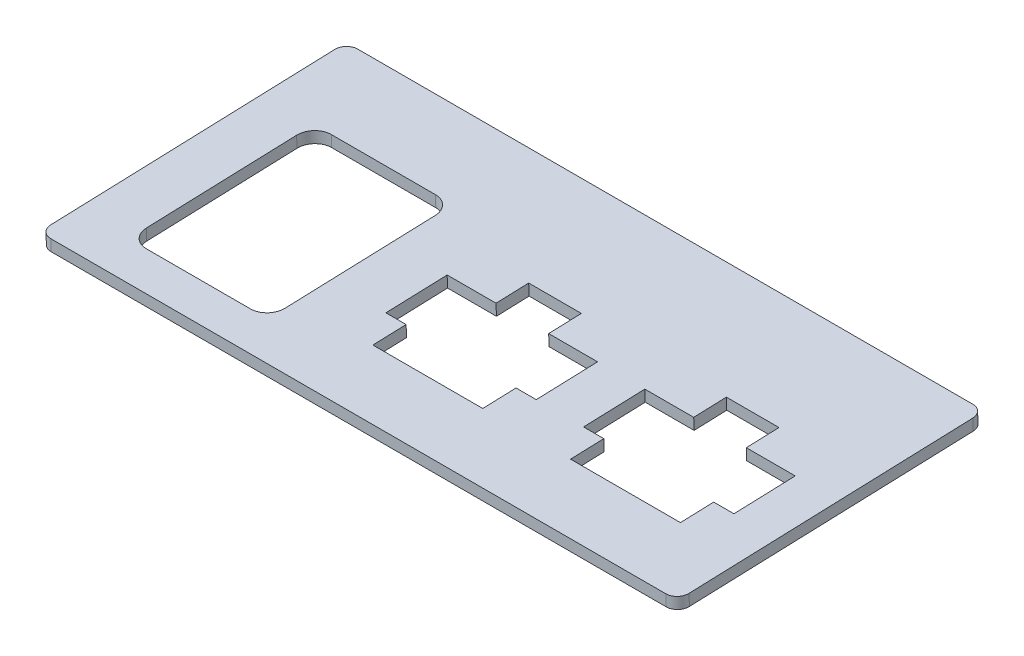
from build123d import *

# Parameters (mm, degrees)
SKETCH1_W           = 110.35
SKETCH1_H           = 53.101321069
BOSS_EXTRUDE1_DEPTH = 2
CUT_EXTRUDE1_REACH  = 75.66
FILLET1_R           = 2


with BuildPart() as part:
    # Sketch1 → Boss-Extrude1 (new body)
    with BuildSketch(Plane(origin=(0, -71.98718802, -2.513847999), x_dir=(1, 0, 0), z_dir=(0, 0.9993908270190958, 0.03489949670250105))):
        with Locations((0, 22.139065255)):
            Rectangle(SKETCH1_W, SKETCH1_H)
    extrude(amount=BOSS_EXTRUDE1_DEPTH)

    # Sketch2 → Cut-Extrude1 (cut, up to next)
    with BuildSketch(Plane(origin=(0, -71.98718802, -2.513847999), x_dir=(1, 0, 0), z_dir=(0, -0.9993908270190958, -0.03489949670250106)), mode=Mode.PRIVATE) as cut_extrude1_sk1:
        Polygon((-4.05, -23.464080484), (-4.05, -29.114080484), (5.05, -29.114080484), (5.05, -23.464080484), (13.5, -23.464080484), (13.5, -12.864080484), (10, -12.864080484), (10, -7.114080484), (-9, -7.114080484), (-9, -12.864080484), (-12.5, -12.864080484), (-12.5, -23.464080484), align=None)
    cut_extrude1_tool1 = extrude(cut_extrude1_sk1.sketch, amount=-CUT_EXTRUDE1_REACH, mode=Mode.PRIVATE) & part.part
    # Sketch2 → Cut-Extrude1 (cut, up to next)
    with BuildSketch(Plane(origin=(0, -71.98718802, -2.513847999), x_dir=(1, 0, 0), z_dir=(0, -0.9993908270190958, -0.03489949670250106)), mode=Mode.PRIVATE) as cut_extrude1_sk2:
        with BuildLine():
            Line((-43.175, -2.114080484), (-25.175, -2.114080484))
            ThreePointArc((-25.175, -2.114080484), (-23.053679656, -2.99276014), (-22.175, -5.114080484))
            Line((-22.175, -5.114080484), (-22.175, -31.114080484))
            ThreePointArc((-22.175, -31.114080484), (-23.053679656, -33.235400827), (-25.175, -34.114080484))
            Line((-25.175, -34.114080484), (-43.175, -34.114080484))
            ThreePointArc((-43.175, -34.114080484), (-45.296320344, -33.235400827), (-46.175, -31.114080484))
            Line((-46.175, -31.114080484), (-46.175, -5.114080484))
            ThreePointArc((-46.175, -5.114080484), (-45.296320344, -2.99276014), (-43.175, -2.114080484))
        make_face()
    cut_extrude1_tool2 = extrude(cut_extrude1_sk2.sketch, amount=-CUT_EXTRUDE1_REACH, mode=Mode.PRIVATE) & part.part
    # Sketch2 → Cut-Extrude1 (cut, up to next)
    with BuildSketch(Plane(origin=(0, -71.98718802, -2.513847999), x_dir=(1, 0, 0), z_dir=(0, -0.9993908270190958, -0.03489949670250106)), mode=Mode.PRIVATE) as cut_extrude1_sk3:
        Polygon((30.125, -23.464080484), (21.675, -23.464080484), (21.675, -12.864080484), (25.175, -12.864080484), (25.175, -7.114080484), (44.175, -7.114080484), (44.175, -12.864080484), (47.675, -12.864080484), (47.675, -23.464080484), (39.225, -23.464080484), (39.225, -29.114080484), (30.125, -29.114080484), align=None)
    cut_extrude1_tool3 = extrude(cut_extrude1_sk3.sketch, amount=-CUT_EXTRUDE1_REACH, mode=Mode.PRIVATE) & part.part
    add(cut_extrude1_tool1.solids().sort_by_distance((0.5, -71.391299, -19.577887))[0], mode=Mode.SUBTRACT)
    add(cut_extrude1_tool2.solids().sort_by_distance((-34.175, -71.355016, -20.616894))[0], mode=Mode.SUBTRACT)
    add(cut_extrude1_tool3.solids().sort_by_distance((34.675, -71.391299, -19.577887))[0], mode=Mode.SUBTRACT)

    # Fillet1
    fillet1_edges = [part.edges().sort_by_distance(p)[0] for p in [
        (-55.175, -71.141759648, 1.929959353),
        (55.175, -71.141759648, 1.929959353),
        (55.175, -69.288550269, -51.139013826),
        (-55.175, -69.288550269, -51.139013826),
    ]]
    fillet(fillet1_edges, radius=FILLET1_R)


solid = part.part
